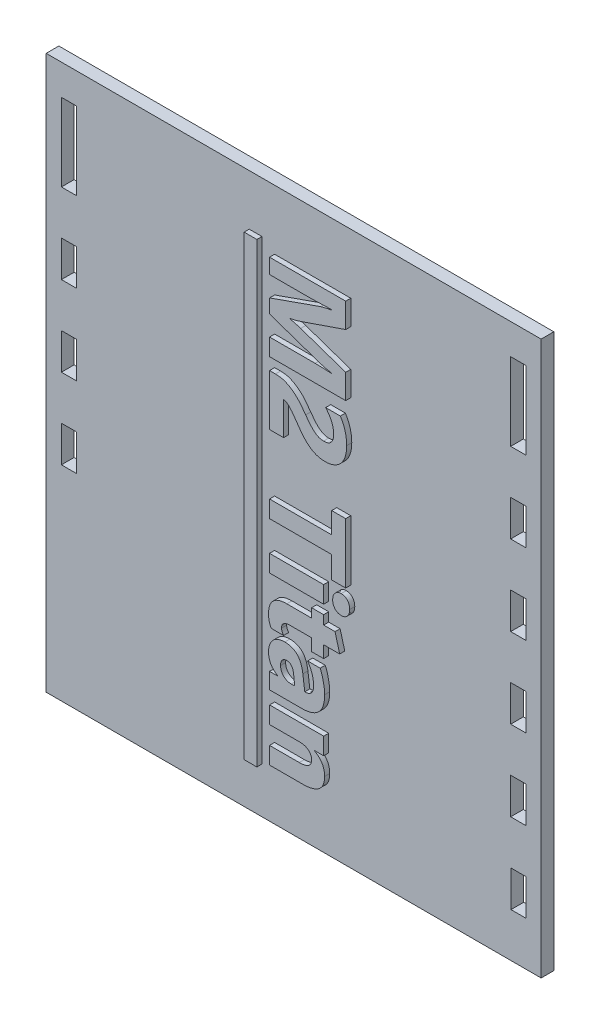
from build123d import *

# Parameters (mm, degrees)
SKETCH1_W           = 123.825
SKETCH1_H           = 138.43
BOSS_EXTRUDE1_DEPTH = 3.175
SKETCH2_W           = 3.81
SKETCH2_H           = 19.431
SKETCH2_H_2         = 9.017
SKETCH2_W_2         = 3.726725707
CUT_EXTRUDE1_DEPTH  = 3.81
SKETCH5_W           = 3.175
SKETCH5_H           = 114.3
SKETCH5_W_2         = 13.535526316
SKETCH5_H_2         = 4.261184211
BOSS_EXTRUDE2_DEPTH = 1.27


with BuildPart() as part:
    # Sketch1 → Boss-Extrude1 (new body)
    with BuildSketch(Plane.XY):
        with Locations((61.9125, 69.215)):
            Rectangle(SKETCH1_W, SKETCH1_H)
    extrude(amount=BOSS_EXTRUDE1_DEPTH)

    # Sketch2 → Cut-Extrude1 (cut)
    with BuildSketch(Plane.XY.offset(3.175)):
        with Locations((5.715, 121.0945)):
            Rectangle(SKETCH2_W, SKETCH2_H)
        with Locations((5.715, 95.8215)):
            Rectangle(SKETCH2_W, SKETCH2_H_2)
        with Locations((5.715, 75.7555)):
            Rectangle(SKETCH2_W, SKETCH2_H_2)
        with Locations((5.715, 55.6895)):
            Rectangle(SKETCH2_W, SKETCH2_H_2)
        with Locations((118.11, 121.0945)):
            Rectangle(SKETCH2_W, SKETCH2_H)
        with Locations((118.11, 95.8215)):
            Rectangle(SKETCH2_W, SKETCH2_H_2)
        with Locations((118.11, 75.7555)):
            Rectangle(SKETCH2_W, SKETCH2_H_2)
        with Locations((118.11, 55.6895)):
            Rectangle(SKETCH2_W, SKETCH2_H_2)
        with Locations((118.11, 35.6235)):
            Rectangle(SKETCH2_W, SKETCH2_H_2)
        with Locations((118.151637147, 15.5575)):
            Rectangle(SKETCH2_W_2, SKETCH2_H_2)
    extrude(amount=-CUT_EXTRUDE1_DEPTH, mode=Mode.SUBTRACT)

    # Sketch5 → Boss-Extrude2 (add)
    # profile 1 of 9: a face of its own
    with BuildSketch(Plane.XY.offset(3.175)):
        with Locations((52.3875, 68.58)):
            Rectangle(SKETCH5_W, SKETCH5_H)
    # profile 2 of 9: a face of its own
    with BuildSketch(Plane.XY.offset(3.175)):
        with BuildLine():
            Line((57.15, 101.9175), (57.15, 106.178684211))
            Line((57.15, 106.178684211), (68.547101151, 106.178684211))
            add(Edge.make_bspline(
                [(68.547101151, 106.178684211), (68.863046339, 106.175629878), (69.5120088, 106.169356171), (70.508408278, 106.142962125), (71.552893128, 106.090680805), (72.26395596, 106.042686605), (72.628125, 106.018106497)],
                knots=[0, 0, 0, 0, 0.928152517, 1.906457722, 2.927797591, 4, 4, 4, 4], degree=3))
            Line((72.628125, 106.018106497), (72.628125, 106.123852796))
            add(Edge.make_bspline(
                [(72.628125, 106.123852796), (72.487117541, 106.151198315), (72.21540985, 106.203890475), (71.821986347, 106.281358345), (71.460684469, 106.36000854), (71.128571044, 106.433679244), (70.828787227, 106.508904656), (70.557686106, 106.577704312), (70.319131092, 106.648548316), (70.17106646, 106.696694876), (70.101963405, 106.719165296)],
                knots=[0, 0, 0, 0, 1.327313991, 2.557605269, 3.705207991, 4.744183751, 5.700973686, 6.5612476, 7.3285217, 8, 8, 8, 8], degree=3))
            Line((70.101963405, 106.719165296), (57.15, 111.160509868))
            Line((57.15, 111.160509868), (57.15, 114.650137747))
            Line((57.15, 114.650137747), (69.968801398, 119.169812911))
            add(Edge.make_bspline(
                [(69.968801398, 119.169812911), (70.019504819, 119.187485416), (70.137819051, 119.228723441), (70.344560255, 119.279300114), (70.601845366, 119.342536572), (70.907392822, 119.418813834), (71.266852338, 119.489240018), (71.674633282, 119.578054004), (72.13411484, 119.671211169), (72.458339275, 119.732848144), (72.628125, 119.765125411)],
                knots=[0, 0, 0, 0, 0.472400556, 1.102326196, 1.871553196, 2.805247711, 3.873500853, 5.09503685, 6.478765868, 8, 8, 8, 8], degree=3))
            Line((72.628125, 119.765125411), (72.628125, 119.882621299))
            add(Edge.make_bspline(
                [(72.628125, 119.882621299), (72.172575491, 119.856315442), (71.291789859, 119.805454185), (70.012144461, 119.756065874), (68.820129558, 119.722491312), (68.053638679, 119.716897461), (67.685464638, 119.714210526)],
                knots=[0, 0, 0, 0, 1.107032083, 2.140399523, 3.106764814, 4, 4, 4, 4], degree=3))
            Line((67.685464638, 119.714210526), (57.15, 119.714210526))
            Line((57.15, 119.714210526), (57.15, 123.474078947))
            Line((57.15, 123.474078947), (76.2, 123.474078947))
            Line((76.2, 123.474078947), (76.2, 117.309461349))
            Line((76.2, 117.309461349), (64.908645148, 113.436013569))
            add(Edge.make_bspline(
                [(64.908645148, 113.436013569), (64.683442113, 113.362053898), (64.234644325, 113.214662736), (63.553067513, 113.032982107), (62.871413996, 112.877674812), (62.414232426, 112.800691265), (62.186657072, 112.762370477)],
                knots=[0, 0, 0, 0, 1.012979573, 2.018724972, 3.013763031, 4, 4, 4, 4], degree=3))
            Line((62.186657072, 112.762370477), (62.186657072, 112.684039885))
            add(Edge.make_bspline(
                [(62.186657072, 112.684039885), (62.441483523, 112.625036023), (62.935388553, 112.510674644), (63.648968748, 112.327304128), (64.311084034, 112.136245176), (64.732758639, 111.998484725), (64.936060855, 111.932066201)],
                knots=[0, 0, 0, 0, 1.100684825, 2.133349073, 3.100030531, 4, 4, 4, 4], degree=3))
            Line((64.936060855, 111.932066201), (76.2, 108.058618421))
            Line((76.2, 108.058618421), (76.2, 101.9175))
            Line((76.2, 101.9175), (57.15, 101.9175))
        make_face()
    # profile 3 of 9: a face of its own
    with BuildSketch(Plane.XY.offset(3.175)):
        with BuildLine():
            Line((60.659210526, 94.397763158), (60.659210526, 86.126052632))
            Line((60.659210526, 86.126052632), (57.15, 86.126052632))
            Line((57.15, 86.126052632), (57.15, 98.909605263))
            Line((57.15, 98.909605263), (58.626531661, 98.909605263))
            add(Edge.make_bspline(
                [(58.626531661, 98.909605263), (58.861892718, 98.904064478), (59.321522061, 98.893244048), (59.99132946, 98.794819095), (60.627215256, 98.646158506), (61.222849985, 98.422935722), (61.781855966, 98.151879289), (62.317755731, 97.860968648), (62.819673151, 97.530723464), (63.289466648, 97.167402029), (63.735712991, 96.784775333), (64.155411445, 96.380675263), (64.547503775, 95.958062558), (65.021577135, 95.379147604), (65.569046885, 94.668069928), (65.979492703, 94.092168161), (66.17760074, 93.814200247)],
                knots=[0, 0, 0, 0, 1.037738054, 2.026566615, 2.98066818, 3.913640251, 4.825629836, 5.720138151, 6.601928887, 7.472817944, 8.338664528, 9.194065608, 10.041792678, 10.880253833, 12.494206153, 14, 14, 14, 14], degree=3))
            add(Edge.make_bspline(
                [(66.17760074, 93.814200247), (66.370124281, 93.547731172), (66.735064922, 93.04262206), (67.287113002, 92.343444547), (67.833665454, 91.753626313), (68.367322945, 91.254640608), (68.911594256, 90.868583523), (69.467478997, 90.586812645), (70.051761037, 90.418777965), (70.452081509, 90.397818694), (70.654194079, 90.387236842)],
                knots=[0, 0, 0, 0, 1.345307172, 2.550115469, 3.64266161, 4.63345688, 5.534626645, 6.363692172, 7.173865932, 8, 8, 8, 8], degree=3))
            add(Edge.make_bspline(
                [(70.654194079, 90.387236842), (70.852120603, 90.39442241), (71.226654642, 90.408019575), (71.750910931, 90.537899937), (72.198721721, 90.754804521), (72.505895062, 91.012974571), (72.703661213, 91.261009256), (72.838507344, 91.467956245), (72.947201076, 91.702147566), (73.036668494, 91.956830632), (73.107571489, 92.234585893), (73.158230215, 92.53447813), (73.183742641, 92.858132443), (73.189255662, 93.080467033), (73.192105263, 93.195388569)],
                knots=[0, 0, 0, 0, 1.639774499, 3.102926038, 4.444626197, 5.735711428, 6.39032154, 7.072313838, 7.779636206, 8.526407238, 9.309222813, 10.154991465, 11.046341759, 12, 12, 12, 12], degree=3))
            add(Edge.make_bspline(
                [(73.192105263, 93.195388569), (73.186054733, 93.399404484), (73.173928802, 93.808274903), (73.075994693, 94.417228233), (72.919225176, 95.019490506), (72.696921681, 95.614273248), (72.414104573, 96.203024111), (72.066589959, 96.783749049), (71.659021622, 97.358438752), (71.346562033, 97.721425696), (71.186842105, 97.906973684)],
                knots=[0, 0, 0, 0, 0.93429968, 1.872439711, 2.818327133, 3.78160406, 4.776793382, 5.806678987, 6.878840384, 8, 8, 8, 8], degree=3))
            Line((71.186842105, 97.906973684), (74.852713816, 97.906973684))
            add(Edge.make_bspline(
                [(74.852713816, 97.906973684), (74.981389983, 97.698683843), (75.237468921, 97.284165426), (75.56091837, 96.630622809), (75.837908598, 95.958540233), (76.058525966, 95.264642545), (76.237906742, 94.552343698), (76.361021605, 93.820260993), (76.438592194, 93.067831077), (76.446600665, 92.559798083), (76.450657895, 92.302419819)],
                knots=[0, 0, 0, 0, 0.993744468, 1.977654705, 2.95721349, 3.943021448, 4.931789968, 5.937566291, 6.955135563, 8, 8, 8, 8], degree=3))
            add(Edge.make_bspline(
                [(76.450657895, 92.302419819), (76.446229739, 92.06726763), (76.437573943, 91.607611317), (76.367680036, 90.936575045), (76.245333823, 90.304491885), (76.081664964, 89.710634315), (75.874860641, 89.156704783), (75.624718253, 88.645925998), (75.331424704, 88.180161301), (75.005082706, 87.75480529), (74.6315553, 87.380438786), (74.224918277, 87.04937183), (73.776095523, 86.770041867), (73.29504365, 86.534897958), (72.779251185, 86.349233849), (72.232249026, 86.222537199), (71.656623363, 86.141555668), (71.262841491, 86.131297375), (71.061513158, 86.126052632)],
                knots=[0, 0, 0, 0, 1.218140337, 2.38112134, 3.490077728, 4.550166081, 5.56899421, 6.549052622, 7.491125593, 8.416540734, 9.320474406, 10.224686385, 11.127328595, 12.052966165, 12.994310448, 13.960595322, 14.957316291, 16, 16, 16, 16], degree=3))
            add(Edge.make_bspline(
                [(71.061513158, 86.126052632), (70.849830202, 86.13185499), (70.435581034, 86.143209811), (69.83167666, 86.21602457), (69.263601146, 86.345718817), (68.73202531, 86.527463626), (68.232364421, 86.753736552), (67.756160799, 87.013512692), (67.302691406, 87.306100964), (66.873326074, 87.633867194), (66.467644451, 87.992399312), (66.073970837, 88.371351108), (65.701361372, 88.780745652), (65.227711877, 89.363710421), (64.661328759, 90.129841392), (64.226751839, 90.759413197), (64.007843339, 91.076546053)],
                knots=[0, 0, 0, 0, 0.983707009, 1.925047808, 2.821284709, 3.686515259, 4.531016264, 5.36717399, 6.205178317, 7.036325298, 7.874680897, 8.719857129, 9.574387443, 10.445151285, 12.209323679, 14, 14, 14, 14], degree=3))
            add(Edge.make_bspline(
                [(64.007843339, 91.076546053), (63.861157232, 91.289940483), (63.571409507, 91.711456549), (63.132716541, 92.31856881), (62.710302451, 92.889058531), (62.281283012, 93.382803782), (61.867587585, 93.803225568), (61.514865035, 94.080703716), (61.238345985, 94.246267293), (61.043019134, 94.333278232), (60.850312697, 94.3893565), (60.722229641, 94.394990923), (60.659210526, 94.397763158)],
                knots=[0, 0, 0, 0, 1.603753862, 3.16788032, 4.639547215, 5.998108781, 7.215978883, 8.288275934, 8.7667161, 9.208419748, 9.610528602, 10, 10, 10, 10], degree=3))
        make_face()
    # profile 4 of 9: a face of its own
    with BuildSketch(Plane.XY.offset(3.175)):
        Polygon((72.690789474, 61.310921053), (72.690789474, 66.825394737), (57.15, 66.825394737), (57.15, 71.086578947), (72.690789474, 71.086578947), (72.690789474, 76.350394737), (76.2, 76.350394737), (76.2, 61.310921053), align=None)
    # profile 5 of 9: a face of its own
    with BuildSketch(Plane.XY.offset(3.175)):
        with BuildLine():
            add(Edge.make_bspline(
                [(72.941447368, 57.175065789), (72.94835957, 57.341655713), (72.961772877, 57.664927806), (73.082789794, 58.124311021), (73.275659107, 58.540160478), (73.553285513, 58.892842985), (73.877732681, 59.189084389), (74.251244078, 59.400903585), (74.659981821, 59.532479492), (74.945718091, 59.54825859), (75.091622122, 59.556315789)],
                knots=[0, 0, 0, 0, 1.114822028, 2.163341225, 3.161496968, 4.166191044, 5.151645171, 6.088374397, 7.023876519, 8, 8, 8, 8], degree=3))
            add(Edge.make_bspline(
                [(75.091622122, 59.556315789), (75.241501063, 59.548603751), (75.531277028, 59.533693294), (75.942563772, 59.401325814), (76.312325857, 59.191936428), (76.622913314, 58.891815264), (76.884001964, 58.537293642), (77.068672435, 58.123250205), (77.186303406, 57.664594046), (77.197076156, 57.341620644), (77.202631579, 57.175065789)],
                knots=[0, 0, 0, 0, 1.007091746, 1.947111311, 2.880734286, 3.84499466, 4.833488051, 5.829035378, 6.880450541, 8, 8, 8, 8], degree=3))
            add(Edge.make_bspline(
                [(77.202631579, 57.175065789), (77.197316569, 57.005865262), (77.187087023, 56.680213115), (77.06787034, 56.218032088), (76.884732995, 55.802338162), (76.625441316, 55.446280016), (76.309390578, 55.155128873), (75.94363767, 54.943427152), (75.530398867, 54.817804861), (75.241333186, 54.802000885), (75.091622122, 54.793815789)],
                knots=[0, 0, 0, 0, 1.135529498, 2.185499205, 3.18767331, 4.174807749, 5.125817136, 6.058156594, 6.994292775, 8, 8, 8, 8], degree=3))
            add(Edge.make_bspline(
                [(75.091622122, 54.793815789), (74.940642491, 54.802127166), (74.647835463, 54.818246093), (74.228141735, 54.943261764), (73.85486076, 55.154956114), (73.530503233, 55.444651163), (73.267814497, 55.80226363), (73.078985902, 56.217032912), (72.962136944, 56.680504073), (72.948522839, 57.005934394), (72.941447368, 57.175065789)],
                knots=[0, 0, 0, 0, 1.00647984, 1.951947891, 2.892102472, 3.848585126, 4.833106091, 5.831027724, 6.872750067, 8, 8, 8, 8], degree=3))
        make_face()
    # profile 6 of 9: a face of its own
    with BuildSketch(Plane.XY.offset(3.175)):
        with Locations((63.917763158, 57.17506579)):
            Rectangle(SKETCH5_W_2, SKETCH5_H_2)
    # profile 7 of 9: a face of its own
    with BuildSketch(Plane.XY.offset(3.175)):
        with BuildLine():
            add(Edge.make_bspline(
                [(57.651315789, 43.263552632), (57.59046431, 43.344410623), (57.465943413, 43.509871016), (57.314835451, 43.791628503), (57.186089938, 44.101504087), (57.080861655, 44.439915682), (56.998192103, 44.807883111), (56.941424203, 45.206006632), (56.905524587, 45.633699766), (56.901443177, 45.928022739), (56.899342105, 46.079537418)],
                knots=[0, 0, 0, 0, 0.817075561, 1.671988646, 2.575546237, 3.526841943, 4.533045372, 5.621098383, 6.775363977, 8, 8, 8, 8], degree=3))
            add(Edge.make_bspline(
                [(56.899342105, 46.079537418), (56.903561841, 46.259804549), (56.91171309, 46.608025911), (56.961265964, 47.114007252), (57.050963445, 47.584544131), (57.176956281, 48.022316344), (57.334388867, 48.427908029), (57.537436416, 48.793531232), (57.769710982, 49.128115189), (58.039951644, 49.425226439), (58.346815238, 49.687815862), (58.688759887, 49.915116239), (59.067524477, 50.107488753), (59.481357958, 50.263806959), (59.931261156, 50.38570244), (60.41666028, 50.468006753), (60.937160481, 50.526864216), (61.296118271, 50.530666161), (61.481681743, 50.532631579)],
                knots=[0, 0, 0, 0, 1.180467923, 2.280305589, 3.324798725, 4.312326957, 5.260016683, 6.166722689, 7.044225914, 7.921729139, 8.788675802, 9.682516048, 10.603892749, 11.564411671, 12.574330037, 13.65089892, 14.785630609, 16, 16, 16, 16], degree=3))
            Line((61.481681743, 50.532631579), (67.677631579, 50.532631579))
            Line((67.677631579, 50.532631579), (67.677631579, 52.788552632))
            Line((67.677631579, 52.788552632), (70.685526316, 52.788552632))
            Line((70.685526316, 52.788552632), (70.685526316, 50.532631579))
            Line((70.685526316, 50.532631579), (73.536759868, 50.532631579))
            Line((73.536759868, 50.532631579), (74.696052632, 46.271447368))
            Line((74.696052632, 46.271447368), (70.685526316, 46.271447368))
            Line((70.685526316, 46.271447368), (70.685526316, 43.263552632))
            Line((70.685526316, 43.263552632), (67.677631579, 43.263552632))
            Line((67.677631579, 43.263552632), (67.677631579, 46.271447368))
            Line((67.677631579, 46.271447368), (62.253238076, 46.271447368))
            add(Edge.make_bspline(
                [(62.253238076, 46.271447368), (62.089848258, 46.265880135), (61.782060416, 46.255392781), (61.349299798, 46.186712945), (60.983740848, 46.052274723), (60.677743552, 45.871079601), (60.441304109, 45.630375347), (60.270053923, 45.336474546), (60.173032414, 44.988892712), (60.163094222, 44.740692669), (60.157894737, 44.610838816)],
                knots=[0, 0, 0, 0, 1.285294615, 2.42119162, 3.428123992, 4.331380918, 5.195274135, 6.051015788, 6.98032608, 8, 8, 8, 8], degree=3))
            add(Edge.make_bspline(
                [(60.157894737, 44.610838816), (60.164109976, 44.500504183), (60.1768309, 44.274678853), (60.279216314, 43.936769164), (60.435758832, 43.592980162), (60.582633737, 43.376447289), (60.659210526, 43.263552632)],
                knots=[0, 0, 0, 0, 0.905449601, 1.853211888, 2.880720029, 4, 4, 4, 4], degree=3))
            Line((60.659210526, 43.263552632), (57.651315789, 43.263552632))
        make_face()
    # profile 8 of 9: a face of its own
    with BuildSketch(Plane.XY.offset(3.175)):
        with BuildLine():
            Line((57.15, 29.728026316), (57.15, 33.738552632))
            Line((57.15, 33.738552632), (59.217927632, 33.738552632))
            Line((59.217927632, 33.738552632), (59.217927632, 33.789467516))
            add(Edge.make_bspline(
                [(59.217927632, 33.789467516), (59.033207836, 33.905011959), (58.673958437, 34.129726755), (58.201012403, 34.53541096), (57.794729835, 34.975279794), (57.466929396, 35.463587028), (57.210512086, 35.990810368), (57.030346387, 36.559429779), (56.916958117, 37.167521256), (56.905319253, 37.587982258), (56.899342105, 37.803910362)],
                knots=[0, 0, 0, 0, 1.071114453, 2.08314015, 3.056566503, 4.010064121, 4.967084619, 5.932353594, 6.938158434, 8, 8, 8, 8], degree=3))
            add(Edge.make_bspline(
                [(56.899342105, 37.803910362), (56.901423993, 37.96337797), (56.905481743, 38.274191871), (56.96378555, 38.725736942), (57.048140734, 39.15211593), (57.168922801, 39.552812052), (57.326881724, 39.925951932), (57.515112438, 40.275976033), (57.743888546, 40.595795757), (58.001761618, 40.892017159), (58.293214851, 41.1513386), (58.602311365, 41.387491663), (58.942387721, 41.578701445), (59.304365591, 41.733982868), (59.685813772, 41.862990903), (60.093802181, 41.94543225), (60.523043409, 42.003936093), (60.818270603, 42.008128272), (60.968616365, 42.010263158)],
                knots=[0, 0, 0, 0, 1.155959924, 2.253049483, 3.296812814, 4.306377995, 5.282522498, 6.231791844, 7.182948782, 8.129047974, 9.074388541, 10.008131741, 10.945469685, 11.895494518, 12.86277906, 13.860190052, 14.910292258, 16, 16, 16, 16], degree=3))
            add(Edge.make_bspline(
                [(60.968616365, 42.010263158), (61.126751116, 42.006404753), (61.436159736, 41.998855344), (61.888195414, 41.942689385), (62.314635193, 41.85442217), (62.715651642, 41.728772148), (63.088968245, 41.562665844), (63.43908994, 41.363308926), (63.762263522, 41.126736666), (64.058961952, 40.853349913), (64.329093553, 40.543177654), (64.572667947, 40.196417001), (64.789066214, 39.81278866), (64.978219515, 39.393645097), (65.150372112, 38.941338159), (65.283679706, 38.448471775), (65.397888028, 37.921622495), (65.452500143, 37.556233938), (65.48045847, 37.369175576)],
                knots=[0, 0, 0, 0, 1.052214364, 2.058777043, 3.026685482, 3.947223142, 4.849706043, 5.740951921, 6.623772368, 7.509239704, 8.420587622, 9.355891272, 10.324735189, 11.347258629, 12.414008604, 13.541850798, 14.74156605, 16, 16, 16, 16], degree=3))
            Line((65.48045847, 37.369175576), (65.966108141, 33.711136924))
            add(Edge.make_bspline(
                [(65.966108141, 33.711136924), (66.139141926, 33.718039831), (66.467199942, 33.731127182), (66.925819205, 33.844808418), (67.3196572, 34.03431533), (67.639877801, 34.307958652), (67.891704715, 34.657528826), (68.059663597, 35.085421578), (68.161451877, 35.58500994), (68.172870073, 35.941703373), (68.178947368, 36.13155222)],
                knots=[0, 0, 0, 0, 1.104455416, 2.093957865, 2.996911891, 3.872905967, 4.757440358, 5.722692457, 6.787910933, 8, 8, 8, 8], degree=3))
            add(Edge.make_bspline(
                [(68.178947368, 36.13155222), (68.174394459, 36.332797446), (68.165290462, 36.73520739), (68.092790751, 37.333835038), (67.974360265, 37.925494078), (67.81055395, 38.508634994), (67.596440335, 39.084032721), (67.337428772, 39.652048029), (67.032420862, 40.2144819), (66.79519069, 40.574548793), (66.675, 40.756973684)],
                knots=[0, 0, 0, 0, 0.977670621, 1.954950128, 2.925349264, 3.907393813, 4.894893809, 5.905534632, 6.938856573, 8, 8, 8, 8], degree=3))
            Line((66.675, 40.756973684), (69.804307155, 40.756973684))
            add(Edge.make_bspline(
                [(69.804307155, 40.756973684), (69.878557366, 40.597416013), (70.036659912, 40.257666485), (70.235941467, 39.69306965), (70.428599906, 39.050436822), (70.595100053, 38.344357884), (70.750371608, 37.618456762), (70.852220121, 36.905080734), (70.926216273, 36.2257981), (70.932919301, 35.783168106), (70.936184211, 35.567571957)],
                knots=[0, 0, 0, 0, 0.789482161, 1.68106108, 2.683984403, 3.799588656, 4.936093584, 6.014182885, 7.032748507, 8, 8, 8, 8], degree=3))
            add(Edge.make_bspline(
                [(70.936184211, 35.567571957), (70.931669938, 35.331113274), (70.922946538, 34.874179432), (70.855973885, 34.210139309), (70.744267072, 33.592948127), (70.587204129, 33.01997998), (70.387929822, 32.491519836), (70.143123584, 32.006913089), (69.844517982, 31.574174618), (69.510113489, 31.179635594), (69.125265581, 30.834708258), (68.692816802, 30.539785001), (68.218824256, 30.287388068), (67.700128141, 30.080208218), (67.136964538, 29.920242628), (66.529948503, 29.807577943), (65.877497228, 29.741490208), (65.42708901, 29.732610658), (65.194551809, 29.728026316)],
                knots=[0, 0, 0, 0, 1.207879657, 2.334112178, 3.405529192, 4.408760094, 5.365043181, 6.28676645, 7.174739385, 8.045027237, 8.923506095, 9.805976336, 10.713056178, 11.661773319, 12.653968959, 13.699156591, 14.812118288, 16, 16, 16, 16], degree=3))
            Line((65.194551809, 29.728026316), (57.15, 29.728026316))
        make_face()
        with BuildLine():
            Line((62.601809211, 33.711136924), (63.459529194, 33.711136924))
            Line((63.459529194, 33.711136924), (63.161872944, 36.194216694))
            add(Edge.make_bspline(
                [(63.161872944, 36.194216694), (63.138283386, 36.355556511), (63.093633681, 36.66093634), (62.972093752, 37.082054937), (62.816925161, 37.441924952), (62.621023931, 37.738742744), (62.380039962, 37.969541497), (62.098353956, 38.133333957), (61.778325279, 38.235177668), (61.551649426, 38.245215274), (61.434683388, 38.250394737)],
                knots=[0, 0, 0, 0, 1.311688495, 2.482730015, 3.518044452, 4.456857195, 5.3268186, 6.179589453, 7.060657736, 8, 8, 8, 8], degree=3))
            add(Edge.make_bspline(
                [(61.434683388, 38.250394737), (61.326888783, 38.244830042), (61.117311101, 38.234010987), (60.819242544, 38.135987852), (60.554194441, 37.973852925), (60.32229079, 37.75303171), (60.135042477, 37.477854602), (59.998629502, 37.154850333), (59.922686851, 36.787805943), (59.912525351, 36.528772523), (59.907236842, 36.393959704)],
                knots=[0, 0, 0, 0, 0.956806197, 1.860252868, 2.756505424, 3.701183051, 4.686872061, 5.696355125, 6.801078025, 8, 8, 8, 8], degree=3))
            add(Edge.make_bspline(
                [(59.907236842, 36.393959704), (59.915301949, 36.204960052), (59.930964763, 35.83791389), (60.080111538, 35.316146983), (60.324677922, 34.849780769), (60.659129359, 34.447155343), (61.064873596, 34.115542878), (61.534214882, 33.883228407), (62.051082332, 33.734795664), (62.414058429, 33.719202532), (62.601809211, 33.711136924)],
                knots=[0, 0, 0, 0, 1.063098103, 2.064586231, 3.028818705, 4.01131852, 4.994864514, 5.958900495, 6.944233431, 8, 8, 8, 8], degree=3))
        make_face(mode=Mode.SUBTRACT)
    # profile 9 of 9: a face of its own
    with BuildSketch(Plane.XY.offset(3.175)):
        with BuildLine():
            Line((57.15, 13.435263158), (57.15, 17.696447368))
            Line((57.15, 17.696447368), (64.571823602, 17.696447368))
            add(Edge.make_bspline(
                [(64.571823602, 17.696447368), (64.6972303, 17.697352658), (64.940535268, 17.699109034), (65.291753206, 17.729558975), (65.62063981, 17.765619439), (65.923966011, 17.824937875), (66.205101688, 17.89781822), (66.460154428, 17.992605228), (66.692587801, 18.101952526), (66.900961367, 18.226514511), (67.085102869, 18.368825133), (67.240985204, 18.532238697), (67.381300881, 18.705708573), (67.485484385, 18.903187501), (67.574012017, 19.111981164), (67.636216267, 19.33965584), (67.671133657, 19.584421988), (67.675427594, 19.752512064), (67.677631579, 19.838789062)],
                knots=[0, 0, 0, 0, 1.40401291, 2.72396388, 3.946363372, 5.10777429, 6.182463603, 7.195608342, 8.150524316, 9.0557879, 9.909890712, 10.74743688, 11.581016947, 12.399063105, 13.238139504, 14.117890822, 15.033954093, 16, 16, 16, 16], degree=3))
            add(Edge.make_bspline(
                [(67.677631579, 19.838789062), (67.668293774, 20.004476434), (67.650004133, 20.32900263), (67.491877223, 20.791986959), (67.222605224, 21.201707955), (66.859453603, 21.555044517), (66.422733178, 21.849293979), (65.91790425, 22.057725189), (65.360082036, 22.184860032), (64.969398984, 22.200310728), (64.767650082, 22.208289474)],
                knots=[0, 0, 0, 0, 0.947536264, 1.855906917, 2.764708675, 3.732693514, 4.740997519, 5.763519213, 6.84508033, 8, 8, 8, 8], degree=3))
            Line((64.767650082, 22.208289474), (57.15, 22.208289474))
            Line((57.15, 22.208289474), (57.15, 26.469473684))
            Line((57.15, 26.469473684), (70.685526316, 26.469473684))
            Line((70.685526316, 26.469473684), (70.685526316, 22.208289474))
            Line((70.685526316, 22.208289474), (68.402189556, 22.208289474))
            Line((68.402189556, 22.208289474), (68.402189556, 22.157374589))
            add(Edge.make_bspline(
                [(68.402189556, 22.157374589), (68.604135368, 22.03314657), (68.996516932, 21.791771007), (69.513454294, 21.35464312), (69.953959617, 20.878437837), (70.313145645, 20.357063511), (70.595001278, 19.794508774), (70.795654378, 19.189461368), (70.914748839, 18.541880677), (70.928934179, 18.096437619), (70.936184211, 17.868774671)],
                knots=[0, 0, 0, 0, 1.084563634, 2.107311714, 3.08905998, 4.047649982, 4.996871209, 5.961131465, 6.957948021, 8, 8, 8, 8], degree=3))
            add(Edge.make_bspline(
                [(70.936184211, 17.868774671), (70.931198719, 17.689763718), (70.921523496, 17.342361486), (70.860297488, 16.836684091), (70.749989408, 16.367500587), (70.602025046, 15.929750615), (70.405038697, 15.528839888), (70.164823396, 15.161314627), (69.880305128, 14.829780262), (69.552516902, 14.533741546), (69.179936298, 14.275220217), (68.768057091, 14.045810747), (68.30880076, 13.860474696), (67.809089484, 13.702315409), (67.264855036, 13.583076841), (66.677067642, 13.498920706), (66.048186069, 13.44142663), (65.613756598, 13.437356149), (65.390378289, 13.435263158)],
                knots=[0, 0, 0, 0, 1.058811276, 2.054809468, 3.006235405, 3.904812537, 4.781902348, 5.640652326, 6.494877957, 7.358611855, 8.24543539, 9.171619222, 10.140923202, 11.168996333, 12.268602782, 13.431526641, 14.679322482, 16, 16, 16, 16], degree=3))
            Line((65.390378289, 13.435263158), (57.15, 13.435263158))
        make_face()
    extrude(amount=BOSS_EXTRUDE2_DEPTH)


solid = part.part
